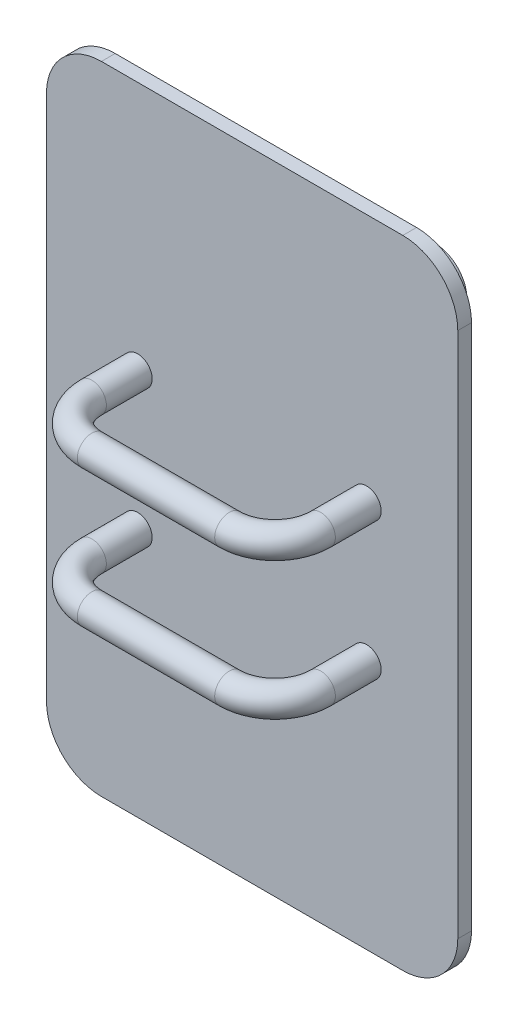
from build123d import *

# Parameters (mm, degrees)
SKETCH1_W           = 79.8
SKETCH1_H           = 129
BOSS_EXTRUDE1_DEPTH = 4
FILLET1_R           = 7
SKETCH2_R           = 3.325
CUT_EXTRUDE2_DEPTH  = 3.2
BOSS_EXTRUDE3_DEPTH = 3
SKETCH6_R           = 3.175


with BuildPart() as part:
    # Sketch1 → Boss-Extrude1 (new body)
    with BuildSketch(Plane.XY):
        with Locations((-91.126473502, -25.83334618)):
            Rectangle(SKETCH1_W, SKETCH1_H)
    extrude(amount=BOSS_EXTRUDE1_DEPTH)

    # Fillet1
    fillet1_edges = [part.edges().sort_by_distance(p)[0] for p in [
        (-51.226473502, -90.33334618, 2),
        (-131.026473502, -90.33334618, 2),
        (-131.026473502, 38.66665382, 2),
        (-51.226473502, 38.66665382, 2),
    ]]
    fillet(fillet1_edges, radius=FILLET1_R)

    # Sketch2 → Cut-Extrude2 (cut)
    with BuildSketch(Plane(origin=(0, 0, 0), x_dir=(-1, 0, 0), z_dir=(0, 0, -1))):
        with Locations((91.126473502, -85.83334618)):
            Circle(SKETCH2_R)
        with Locations((126.526473502, -56.58334618)):
            Circle(SKETCH2_R)
        with Locations((126.526473502, 1.91665382)):
            Circle(SKETCH2_R)
        with Locations((55.726473502, -56.58334618)):
            Circle(SKETCH2_R)
        with Locations((55.726473502, 1.91665382)):
            Circle(SKETCH2_R)
        with Locations((91.126473502, 34.16665382)):
            Circle(SKETCH2_R)
    extrude(amount=-CUT_EXTRUDE2_DEPTH, mode=Mode.SUBTRACT)

    # Sketch3 → Boss-Extrude3 (add)
    with BuildSketch(Plane.XY.offset(4)):
        with BuildLine():
            ThreePointArc((-136.026473502, -83.33334618), (-132.511754876, -91.818627555), (-124.026473502, -95.33334618))
            Line((-124.026473502, -95.33334618), (-58.226473502, -95.33334618))
            ThreePointArc((-58.226473502, -95.33334618), (-49.741192128, -91.818627555), (-46.226473502, -83.33334618))
            Line((-46.226473502, -83.33334618), (-46.226473502, 31.66665382))
            ThreePointArc((-46.226473502, 31.66665382), (-49.741192128, 40.151935194), (-58.226473502, 43.66665382))
            Line((-58.226473502, 43.66665382), (-124.026473502, 43.66665382))
            ThreePointArc((-124.026473502, 43.66665382), (-132.511754876, 40.151935194), (-136.026473502, 31.66665382))
            Line((-136.026473502, 31.66665382), (-136.026473502, -83.33334618))
        make_face()
    extrude(amount=BOSS_EXTRUDE3_DEPTH)

    # Sweep1: sweep along a curve in space
    with BuildLine() as sweep1_path:
        Line((-116.126473502, -10.83334618, 7), (-116.126473502, -10.83334618, 17))
        ThreePointArc((-116.126473502, -10.83334618, 17), (-113.197541314, -10.83334618, 24.071067812), (-106.126473502, -10.83334618, 27))
        Line((-106.126473502, -10.83334618, 27), (-76.126473502, -10.83334618, 27))
        ThreePointArc((-66.126473502, -10.83334618, 17), (-69.05540569, -10.83334618, 24.071067812), (-76.126473502, -10.83334618, 27))
        Line((-66.126473502, -10.83334618, 17), (-66.126473502, -10.83334618, 7))
    # Sketch6 → Sweep1 (sweep)
    with BuildSketch(Plane.XY.offset(7)):
        with Locations((-116.126473502, -10.83334618)):
            Circle(SKETCH6_R)
        with Locations((-116.126473502, -40.83334618)):
            Circle(SKETCH6_R)
    sweep(path=sweep1_path.line)


solid = part.part
